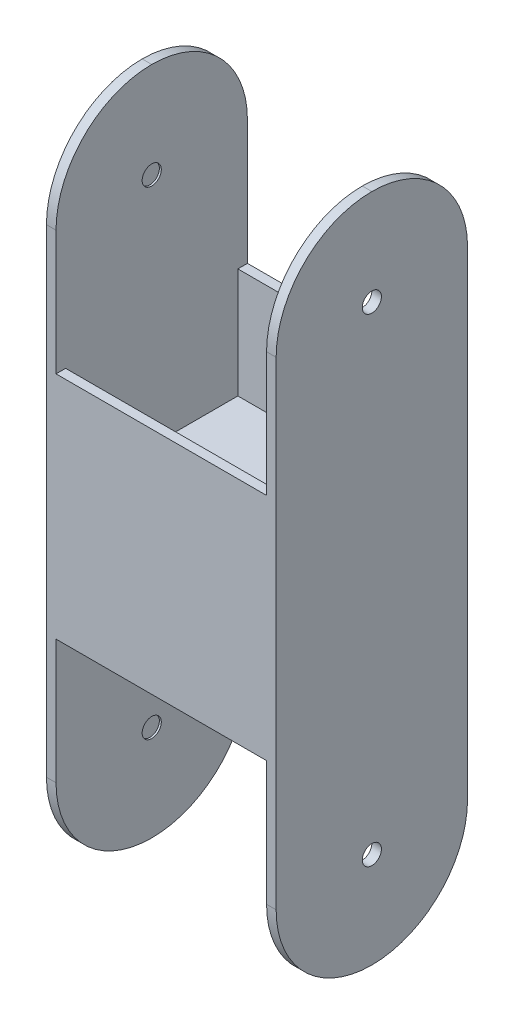
from build123d import *

# Parameters (mm, degrees)
BOSS_EXTRUDE1_DEPTH = 100
FILLET1_R           = 50
SKETCH2_R           = 5
CUT_EXTRUDE1_DEPTH  = 116
SKETCH5_W           = 120
SKETCH5_H           = 120
BOSS_EXTRUDE4_DEPTH = 5
SKETCH6_W           = 110
SKETCH6_H           = 120
BOSS_EXTRUDE6_DEPTH = 5


with BuildPart() as part:
    # Sketch1 → Boss-Extrude1 (new body)
    with BuildSketch(Plane.XY):
        Polygon((5, -172.5), (5, -8), (5, 0), (0, 0), (0, -8), (0, -146), (0, -154), (0, -292), (0, -350), (5, -350), (5, -292), (5, -177.5), (115, -177.5), (115, -293.5), (115, -350), (120, -350), (120, -293.5), (120, -155.5), (120, -147.5), (120, -9.5), (120, 0), (115, 0), (115, -9.5), (115, -172.5), align=None)
    extrude(amount=BOSS_EXTRUDE1_DEPTH)

    # Fillet1
    fillet1_edges = [part.edges().sort_by_distance(p)[0] for p in [
        (2.5, 0, 100),
        (2.5, 0, 0),
        (117.5, -350, 0),
        (117.5, -350, 100),
        (2.5, -350, 100),
        (2.5, -350, 0),
        (117.5, 0, 100),
        (117.5, 0, 0),
    ]]
    fillet(fillet1_edges, radius=FILLET1_R - 0.0001)  # a hair under: the kernel refuses the full size

    # Sketch2 → Cut-Extrude1 (cut)
    with BuildSketch(Plane(origin=(120, 0, 0), x_dir=(0, 0, -1), z_dir=(1, 0, 0))):
        with Locations(Location((-50, -300, 0), (0, 0, 90))):
            Circle(SKETCH2_R)
        with Locations(Location((-50, -50, 0), (0, 0, 90))):
            Circle(SKETCH2_R)
    extrude(amount=-CUT_EXTRUDE1_DEPTH, mode=Mode.SUBTRACT)

    # Sketch5 → Boss-Extrude4 (add)
    with BuildSketch(Plane.XY.offset(100)):
        with Locations((60, -175)):
            Rectangle(SKETCH5_W, SKETCH5_H)
    extrude(amount=-BOSS_EXTRUDE4_DEPTH)

    # Sketch6 → Boss-Extrude6 (add)
    with BuildSketch(Plane(origin=(0, 0, 0), x_dir=(-1, 0, 0), z_dir=(0, 0, -1))):
        with Locations((-60, -175)):
            Rectangle(SKETCH6_W, SKETCH6_H)
    extrude(amount=-BOSS_EXTRUDE6_DEPTH)


solid = part.part
